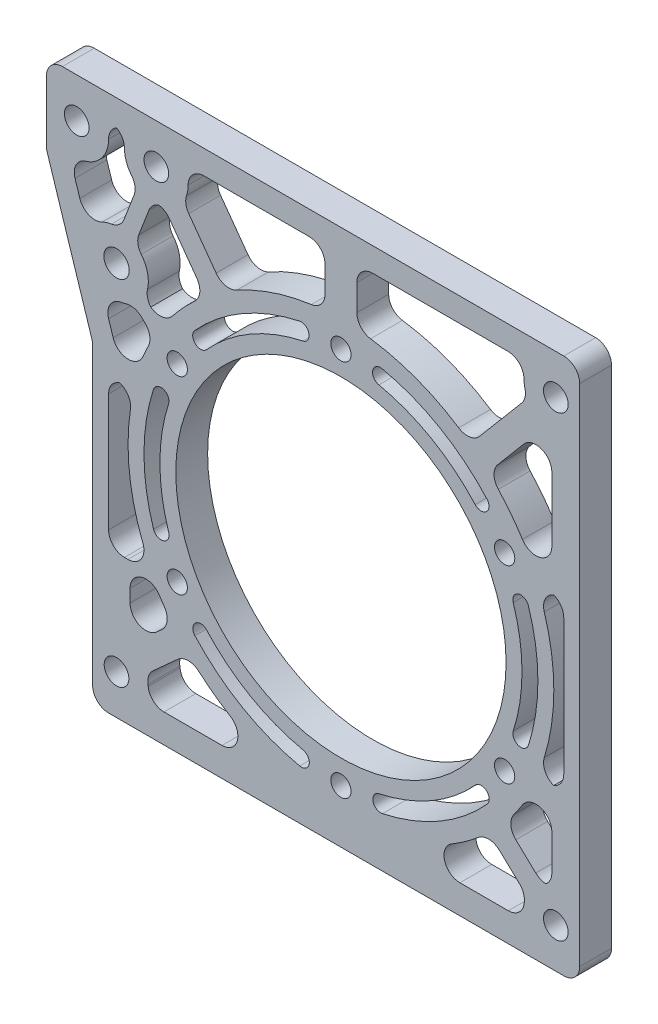
from build123d import *

# Parameters (mm, degrees)
SKETCH_1_R          = 1.55
SKETCH_1_R_2        = 1.6
SKETCH_1_R_3        = 1.275
SKETCH_1_R_4        = 20.75
EXTRUDE_1_DEPTH     = 4
CUT_EXTRUDE_1_DEPTH = 10
EXTRUDE_2_DEPTH     = 4
FILLET_1_R          = 2
FILLET_2_R          = 2
CUT_EXTRUDE_2_DEPTH = 10
FILLET_3_R          = 2
CUT_EXTRUDE_3_DEPTH = 10
FILLET_4_R          = 2


with BuildPart() as part:
    # 草图1 → 凸台-拉伸1 (new body)
    with BuildSketch(Plane.XY):
        Polygon((-37, 37), (-37, 27), (-31.2, 8.893125), (-31.2, -30.45), (30, -30.45), (30, 37), align=None)
        with Locations((-28.2, -25.45)):
            Circle(SKETCH_1_R, mode=Mode.SUBTRACT)
        with Locations((27, -25.45)):
            Circle(SKETCH_1_R, mode=Mode.SUBTRACT)
        with Locations((-28.2, 19)):
            Circle(SKETCH_1_R_2, mode=Mode.SUBTRACT)
        with Locations((-33.2, 32)):
            Circle(SKETCH_1_R, mode=Mode.SUBTRACT)
        with Locations((-23.2, 32)):
            Circle(SKETCH_1_R, mode=Mode.SUBTRACT)
        with Locations((27, 32)):
            Circle(SKETCH_1_R, mode=Mode.SUBTRACT)
        with Locations((20.56810334, 11.875)):
            Circle(SKETCH_1_R_3, mode=Mode.SUBTRACT)
        with Locations((0, 23.75)):
            Circle(SKETCH_1_R_3, mode=Mode.SUBTRACT)
        with Locations((-20.56810334, -11.875)):
            Circle(SKETCH_1_R_3, mode=Mode.SUBTRACT)
        with Locations((0, -23.75)):
            Circle(SKETCH_1_R_3, mode=Mode.SUBTRACT)
        Circle(SKETCH_1_R_4, mode=Mode.SUBTRACT)
        with Locations((20.56810334, -11.875)):
            Circle(SKETCH_1_R_3, mode=Mode.SUBTRACT)
        with Locations((-20.56810334, 11.875)):
            Circle(SKETCH_1_R_3, mode=Mode.SUBTRACT)
    extrude(amount=EXTRUDE_1_DEPTH)

    # 草图3 → 切除-拉伸1 (cut)
    with BuildSketch(Plane.XY.offset(4)):
        with BuildLine():
            ThreePointArc((-2.842094298, -26.85), (-18.240699261, -19.906704661), (-26.5, -5.172040216))
            Line((-26.5, -5.172040216), (-26.5, -21.829226602))
            ThreePointArc((-26.5, -21.829226602), (-24.823611397, -23.305238941), (-24.2, -25.45))
            ThreePointArc((-24.2, -25.45), (-24.263758443, -26.161338458), (-24.453001201, -26.85))
            Line((-24.453001201, -26.85), (-2.842094298, -26.85))
        make_face()
        with BuildLine():
            Line((26.5, -21.481373033), (26.5, -5.172040216))
            ThreePointArc((26.5, -5.172040216), (18.240699261, -19.906704661), (2.842094298, -26.85))
            Line((2.842094298, -26.85), (23.253001201, -26.85))
            ThreePointArc((23.253001201, -26.85), (23.577312667, -23.379924778), (26.5, -21.481373033))
        make_face()
        with BuildLine():
            ThreePointArc((-22.188158235, 28.13009351), (-26.380777443, 29.574581509), (-26.664101615, 34))
            Line((-26.664101615, 34), (-28.2, 34))
            Line((-28.2, 34), (-28.2, 23))
            ThreePointArc((-28.2, 23), (-26.048701334, 22.372226868), (-24.572666419, 20.685957025))
            Line((-24.572666419, 20.685957025), (-22.188158235, 28.13009351))
        make_face()
        with BuildLine():
            Line((-28.2, 23), (-28.2, 34))
            Line((-28.2, 34), (-29.735898385, 34))
            ThreePointArc((-29.735898385, 34), (-29.336296695, 33.03527618), (-29.2, 32))
            ThreePointArc((-29.2, 32), (-30.755349418, 28.83397986), (-34.211841765, 28.13009351))
            Line((-34.211841765, 28.13009351), (-31.827333581, 20.685957025))
            ThreePointArc((-31.827333581, 20.685957025), (-30.351298666, 22.372226868), (-28.2, 23))
        make_face()
        with BuildLine():
            Line((23.535898385, 34), (-19.735898385, 34))
            ThreePointArc((-19.735898385, 34), (-19.336296695, 33.03527618), (-19.2, 32))
            ThreePointArc((-19.2, 32), (-20.03397986, 29.555349418), (-22.188158235, 28.13009351))
            Line((-22.188158235, 28.13009351), (-24.572666419, 20.685957025))
            ThreePointArc((-24.572666419, 20.685957025), (-24.294277639, 19.863326611), (-24.2, 19))
            ThreePointArc((-24.2, 19), (-26.18637327, 15.543801598), (-30.172653696, 15.520253257))
            Line((-30.172653696, 15.520253257), (-26.629343566, 4.458481945))
            ThreePointArc((-26.629343566, 4.458481945), (-0.362593148, 26.99756519), (26.5, 5.172040216))
            Line((26.5, 5.172040216), (26.5, 28.031373033))
            ThreePointArc((26.5, 28.031373033), (23.417451693, 30.220857614), (23.535898385, 34))
        make_face()
    extrude(amount=-CUT_EXTRUDE_1_DEPTH, mode=Mode.SUBTRACT)

    # 草图4 → 凸台-拉伸2 (add)
    with BuildSketch(Plane.XY.offset(4)):
        Polygon((-26.516257498, 16.060033409), (-22.871840665, 12.657672096), (-21.507010027, 14.119601414), (-25.814048103, 18.140573874), align=None)
        Polygon((-25.073663933, 29.91415143), (-28.349086461, 21.398052857), (-26.206257495, 21.398052857), (-23.20697272, 29.196193271), align=None)
        Polygon((-22.689977833, 28.741013702), (-16.391570473, 20.053555275), (-13.962739143, 21.814457989), (-20.435109375, 30.741865206), align=None)
        Polygon((-2, 25.068796622), (-2, 35.260601513), (2, 34.683706896), (2, 26.158486453), align=None)
        Polygon((15.144686244, 20.275304594), (23.812232733, 30.547952285), (26.105107183, 28.613339467), (17.511605924, 18.428449087), align=None)
        Polygon((-20.408358069, -16.128240134), (-27.366474534, -22.407816874), (-25.35652789, -24.634948322), (-17.961616152, -17.961171593), align=None)
        Polygon((17.198262258, -18.272284712), (23.653008975, -24.356481155), (25.94176779, -22.391188055), (19.436545806, -16.259414), align=None)
    extrude(amount=-EXTRUDE_2_DEPTH)

    # 圆角1
    # the kernel refuses this fillet: 2 mm, written as the material it adds along each edge
    with BuildSketch(Plane(origin=(26.5, -5.172040216, 4), x_dir=(0, -1, 0), z_dir=(0, 0, -1))) as fillet_1_piece_1:
        with BuildLine():
            CenterArc((10.344080433, 2), FILLET_1_R, 122.346532129, 147.653467871)
            Line((9.274003147, 3.689655172), (9.252601601, 3.723448276))
            ThreePointArc((9.252601601, 3.723448276), (4.794189557, 1.449733253), (-0.007662282, 0.039259259))
            Line((-0.007662282, 0.039259259), (0, -0.04))
            Line((0, -0.04), (10.344080433, -0.04))
            Line((10.344080433, -0.04), (10.344080433, 0))
        make_face()
    extrude(amount=4)
    with BuildSketch(Plane(origin=(26.5, 5.172040216, 4), x_dir=(-0.3696672764454741, 0.9291641968594062, 0), z_dir=(0, 0, -1))) as fillet_1_piece_2:
        with BuildLine():
            CenterArc((10.35068374, 1.965539647), FILLET_1_R, 111.695098828, 147.653467871)
            Line((9.611349188, 3.823868041), (9.596562497, 3.861034609))
            Line((9.596562497, 3.861034609), (-0.014786691, 0.037166568))
            Line((-0.014786691, 0.037166568), (0.007393346, -0.039310793))
            ThreePointArc((0.007393346, -0.039310793), (4.990508232, 0.425214763), (9.973623118, -0.039310793))
            Line((9.973623118, -0.039310793), (9.981016464, 0))
        make_face()
    extrude(amount=4)
    with BuildSketch(Plane(origin=(26.5, 28.031373033, 4), x_dir=(0, -1, 0), z_dir=(0, 0, -1))) as fillet_1_piece_3:
        with BuildLine():
            CenterArc((1.389826656, 2), FILLET_1_R, 218.872973668, 51.127026332)
            Line((-0.167251886, 0.744808217), (-0.198393457, 0.719704381))
            ThreePointArc((-0.198393457, 0.719704381), (-0.104846097, 0.367638975), (-0.03968627, -0.005))
            Line((-0.03968627, -0.005), (0, -0.04))
            Line((0, -0.04), (1.389826656, -0.04))
            Line((1.389826656, -0.04), (1.389826656, 0))
        make_face()
    extrude(amount=4)
    with BuildSketch(Plane(origin=(18.531062197, 19.636693557, 0), x_dir=(0.7044568194517202, -0.709746848903161, 0), z_dir=(0, 0, 1)), Plane(origin=(18.588298073, -19.582522175, 0), x_dir=(-0.7473994868291617, -0.6643748995014079, 0), z_dir=(0, 0, 1)), Plane(origin=(-14.609232882, 22.706173491, 0), x_dir=(0.8582101658204371, 0.513298462185947, 0), z_dir=(0, 0, 1))) as fillet_1_piece_4:
        with BuildLine():
            CenterArc((1.830885237, 1.998930792), FILLET_1_R, 185.058322367, 83.068093802)
            Line((-0.161325693, 1.822591309), (-0.201169911, 1.81906452))
            Line((-0.201169911, 1.81906452), (-0.039844219, -0.00352679))
            Line((-0.039844219, -0.00352679), (0.001307775, -0.039978616))
            ThreePointArc((0.001307775, -0.039978616), (0.882748239, -0.025565689), (1.764188703, -0.039978616))
            Line((1.764188703, -0.039978616), (1.765496478, 0))
        make_face()
    extrude(amount=4)
    with BuildSketch(Plane(origin=(-26.664101615, 34, 4), x_dir=(-0.25881904510252357, -0.9659258262890674, 0), z_dir=(0, 0, -1)), Plane(origin=(23.535898385, 34, 4), x_dir=(-0.2588190451025201, -0.9659258262890685, 0), z_dir=(0, 0, -1))) as fillet_1_piece_5:
        with BuildLine():
            CenterArc((2.588190451, 1.931851653), FILLET_1_R, 165, 90)
            Line((0.656338798, 2.449489743), (0.617701765, 2.459842505))
            Line((0.617701765, 2.459842505), (-0.038637033, 0.010352762))
            Line((-0.038637033, 0.010352762), (0.010352762, -0.038637033))
            ThreePointArc((0.010352762, -0.038637033), (1.03527618, 0.096296695), (2.060199599, -0.038637033))
            Line((2.060199599, -0.038637033), (2.070552361, 0))
        make_face()
    extrude(amount=4)
    with BuildSketch(Plane(origin=(-29.735898385, 34, 4), x_dir=(1, 0, 0), z_dir=(0, 0, -1)), Plane(origin=(-19.735898385, 34, 4), x_dir=(1, 0, 0), z_dir=(0, 0, -1))) as fillet_1_piece_6:
        with BuildLine():
            CenterArc((2.535898385, 2), FILLET_1_R, 180, 90)
            Line((0.535898385, 2), (0.495898385, 2))
            ThreePointArc((0.495898385, 2), (0.360964657, 0.975076581), (-0.034641016, 0.02))
            Line((-0.034641016, 0.02), (0, -0.04))
            Line((0, -0.04), (2.535898385, -0.04))
            Line((2.535898385, -0.04), (2.535898385, 0))
        make_face()
    extrude(amount=4)
    with BuildSketch(Plane(origin=(-34.211841765, 28.13009351, 4), x_dir=(0.9998857758869276, 0.015114072217531128, 0), z_dir=(0, 0, -1))) as fillet_1_piece_7:
        with BuildLine():
            CenterArc((2.675540586, 1.927085702), FILLET_1_R, 163.104687221, 91.376541996)
            Line((0.761865861, 2.508333538), (0.723592366, 2.519958495))
            Line((0.723592366, 2.519958495), (-0.038273494, 0.011624957))
            Line((-0.038273494, 0.011624957), (0.010702162, -0.038541714))
            ThreePointArc((0.010702162, -0.038541714), (1.070216234, 0.105828596), (2.129730306, -0.038541714))
            Line((2.129730306, -0.038541714), (2.140432469, 0))
        make_face()
    extrude(amount=4)
    with BuildSketch(Plane(origin=(-31.827333581, 20.685957025, 4), x_dir=(-0.3050524308865609, 0.9523355576739746, 0), z_dir=(0, 0, -1))) as fillet_1_piece_8:
        with BuildLine():
            CenterArc((3.213764291, 2), FILLET_1_R, 170.985239348, 99.014760652)
            Line((1.238468278, 2.31337782), (1.198962357, 2.319645377))
            ThreePointArc((1.198962357, 2.319645377), (0.779065261, 1.071123218), (-0.027121237, 0.029401335))
            Line((-0.027121237, 0.029401335), (0, -0.04))
            Line((0, -0.04), (3.213764291, -0.04))
            Line((3.213764291, -0.04), (3.213764291, 0))
        make_face()
    extrude(amount=4)
    with BuildSketch(Plane(origin=(-27.74302561, 22.973811068, 0), x_dir=(-0.9997802281489468, -0.020964145640583874, 0), z_dir=(0, 0, 1)), Plane(origin=(-24.686570731, 17.087981493, 0), x_dir=(0.35500772832201655, 0.9348633658624351, 0), z_dir=(0, 0, 1)), Plane(origin=(-23.65697439, 28.026188932, 0), x_dir=(0.9997802281489468, 0.02096414564058723, 0), z_dir=(0, 0, 1))) as fillet_1_piece_9:
        with BuildLine():
            CenterArc((1.350453784, -1.981678829), FILLET_1_R, 97.761243907, 60)
            Line((-0.500775803, -1.224744871), (-0.537800395, -1.209606192))
            Line((-0.537800395, -1.209606192), (-0.037024592, 0.015138679))
            Line((-0.037024592, 0.015138679), (0.005401815, 0.039633577))
            ThreePointArc((0.005401815, 0.039633577), (0.540181513, 0.003357659), (1.074961212, 0.039633577))
            Line((1.074961212, 0.039633577), (1.080363027, 0))
        make_face()
    extrude(amount=4)
    with BuildSketch(Plane(origin=(-25.523665602, 28.74414709, 0), x_dir=(-0.7280567727843938, 0.6855168383072539, 0), z_dir=(0, 0, 1)), Plane(origin=(-26.051401369, 15.626052176, 0), x_dir=(-0.9082997007060751, -0.4183200374082674, 0), z_dir=(0, 0, 1)), Plane(origin=(-25.876334398, 22.25585291, 0), x_dir=(0.7280567727843936, -0.6855168383072539, 0), z_dir=(0, 0, 1))) as fillet_1_piece_10:
        with BuildLine():
            CenterArc((1.350453784, 1.981678829), FILLET_1_R, 202.238756093, 60)
            Line((-0.500775803, 1.224744871), (-0.537800395, 1.209606192))
            Line((-0.537800395, 1.209606192), (-0.037024592, -0.015138679))
            Line((-0.037024592, -0.015138679), (0.005401815, -0.039633577))
            ThreePointArc((0.005401815, -0.039633577), (0.540181513, -0.003357659), (1.074961212, -0.039633577))
            Line((1.074961212, -0.039633577), (1.080363027, 0))
        make_face()
    extrude(amount=4)
    with BuildSketch(Plane(origin=(-26.629343566, 4.458481945, 4), x_dir=(-0.30505243088655853, 0.9523355576739752, 0), z_dir=(0, 0, -1))) as fillet_1_piece_11:
        with BuildLine():
            CenterArc((6.525126751, 2), FILLET_1_R, 130.657248638, 139.342751362)
            Line((5.222061673, 3.517241379), (5.196000372, 3.547586207))
            ThreePointArc((5.196000372, 3.547586207), (2.691558896, 1.639060374), (-0.018324914, 0.035555556))
            Line((-0.018324914, 0.035555556), (0, -0.04))
            Line((0, -0.04), (6.525126751, -0.04))
            Line((6.525126751, -0.04), (6.525126751, 0))
        make_face()
    extrude(amount=4)
    with BuildSketch(Plane(origin=(-30.172653696, 15.520253257, 4), x_dir=(0.3050524308865576, -0.9523355576739755, 0), z_dir=(0, 0, -1))) as fillet_1_piece_12:
        with BuildLine():
            CenterArc((3.213764291, -2), FILLET_1_R, 90, 99.014760652)
            Line((1.238468278, -2.31337782), (1.198962357, -2.319645377))
            ThreePointArc((1.198962357, -2.319645377), (0.779065261, -1.071123218), (-0.027121237, -0.029401335))
            Line((-0.027121237, -0.029401335), (0, 0.04))
            Line((0, 0.04), (3.213764291, 0.04))
            Line((3.213764291, 0.04), (3.213764291, 0))
        make_face()
    extrude(amount=4)
    with BuildSketch(Plane(origin=(-23.518721711, 13.261588482, 0), x_dir=(-0.4671901867140015, -0.8841568466274162, 0), z_dir=(0, 0, 1))) as fillet_1_piece_13:
        with BuildLine():
            CenterArc((1.529854182, -1.999253543), FILLET_1_R, 91.565448117, 73.253937268)
            Line((-0.400356114, -1.47552822), (-0.43896032, -1.465053714))
            Line((-0.43896032, -1.465053714), (-0.038604206, 0.010474506))
            Line((-0.038604206, 0.010474506), (0.001092753, 0.039985071))
            ThreePointArc((0.001092753, 0.039985071), (0.737608267, 0.029922824), (1.47412378, 0.039985071))
            Line((1.47412378, 0.039985071), (1.475216533, 0))
        make_face()
    extrude(amount=4)
    with BuildSketch(Plane(origin=(-22.449982288, 14.999943176, 0), x_dir=(0.5886464024816235, 0.8083906313444278, 0), z_dir=(0, 0, 1))) as fillet_1_piece_14:
        with BuildLine():
            CenterArc((2.259263534, 1.998371699), FILLET_1_R, 173.028337417, 94.659494613)
            Line((0.274050925, 2.241128567), (0.234346672, 2.245983705))
            Line((0.234346672, 2.245983705), (-0.039704252, 0.004855137))
            Line((-0.039704252, 0.004855137), (0.00161376, -0.039967434))
            ThreePointArc((0.00161376, -0.039967434), (1.089287775, -0.018017943), (2.176961791, -0.039967434))
            Line((2.176961791, -0.039967434), (2.17857555, 0))
        make_face()
    extrude(amount=4)
    with BuildSketch(Plane(origin=(-22.237881657, 28.11743277, 0), x_dir=(-0.992359336250492, -0.12338131040187164, 0), z_dir=(0, 0, 1)), Plane(origin=(25.33053642, -21.815045894, 0), x_dir=(0.9519270489112265, 0.3063248170670529, 0), z_dir=(0, 0, 1)), Plane(origin=(23.462317333, 30.133237737, 0), x_dir=(-0.3581915861106433, 0.9336481069651145, 0), z_dir=(0, 0, 1))) as fillet_1_piece_15:
        with BuildLine():
            CenterArc((1.189327218, 1.985804631), FILLET_1_R, 208.854823775, 54.314665287)
            Line((-0.562363402, 1.020620726), (-0.597397215, 1.001317048))
            Line((-0.597397215, 1.001317048), (-0.035033812, -0.019303678))
            Line((-0.035033812, -0.019303678), (0.004757309, -0.039716093))
            ThreePointArc((0.004757309, -0.039716093), (0.475730887, -0.011609261), (0.946704466, -0.039716093))
            Line((0.946704466, -0.039716093), (0.951461775, 0))
        make_face()
    extrude(amount=4)
    with BuildSketch(Plane(origin=(-17.038064212, 20.945270777, 0), x_dir=(-0.7547046080004547, -0.6560647488341985, 0), z_dir=(0, 0, 1)), Plane(origin=(20.646030924, -17.399465713, 0), x_dir=(0.6190798045360487, 0.7853280815147309, 0), z_dir=(0, 0, 1)), Plane(origin=(16.238187746, 21.571306375, 0), x_dir=(-0.8181730271779358, 0.574972084190609, 0), z_dir=(0, 0, 1))) as fillet_1_piece_16:
        with BuildLine():
            CenterArc((1.830885237, -1.998930792), FILLET_1_R, 91.87358383, 83.068093802)
            Line((-0.161325693, -1.822591309), (-0.201169911, -1.81906452))
            Line((-0.201169911, -1.81906452), (-0.039844219, 0.00352679))
            Line((-0.039844219, 0.00352679), (0.001307775, 0.039978616))
            ThreePointArc((0.001307775, 0.039978616), (0.882748239, 0.025565689), (1.764188703, 0.039978616))
            Line((1.764188703, 0.039978616), (1.765496478, 0))
        make_face()
    extrude(amount=4)
    with BuildSketch(Plane(origin=(-26.5, -5.172040216, 4), x_dir=(0, -1, 0), z_dir=(0, 0, -1))) as fillet_1_piece_17:
        with BuildLine():
            CenterArc((10.344080433, -2), FILLET_1_R, 90, 147.653467871)
            Line((9.274003147, -3.689655172), (9.252601601, -3.723448276))
            ThreePointArc((9.252601601, -3.723448276), (4.794189557, -1.449733253), (-0.007662282, -0.039259259))
            Line((-0.007662282, -0.039259259), (0, 0.04))
            Line((0, 0.04), (10.344080433, 0.04))
            Line((10.344080433, 0.04), (10.344080433, 0))
        make_face()
    extrude(amount=4)
    with BuildSketch(Plane(origin=(-21.14338242, -16.791586579, 0), x_dir=(-0.5961642987472975, 0.8028624595154159, 0), z_dir=(0, 0, 1))) as fillet_1_piece_18:
        with BuildLine():
            CenterArc((1.817728363, 1.998946107), FILLET_1_R, 185.470015242, 82.669869386)
            Line((-0.17316408, 1.808296475), (-0.212981929, 1.804483483))
            Line((-0.212981929, 1.804483483), (-0.039817849, -0.003812993))
            Line((-0.039817849, -0.003812993), (0.001298377, -0.039978922))
            ThreePointArc((0.001298377, -0.039978922), (0.876404746, -0.02577245), (1.751511115, -0.039978922))
            Line((1.751511115, -0.039978922), (1.752809493, 0))
        make_face()
    extrude(amount=4)
    with BuildSketch(Plane(origin=(2.842094298, -26.85, 4), x_dir=(1, 0, 0), z_dir=(0, 0, -1))) as fillet_1_piece_19:
        with BuildLine():
            CenterArc((12.107069558, -2), FILLET_1_R, 90, 148.969893499)
            Line((11.07609274, -3.713793103), (11.055473204, -3.748068966))
            ThreePointArc((11.055473204, -3.748068966), (5.728593443, -1.288605053), (-0.00421051, -0.039777778))
            Line((-0.00421051, -0.039777778), (0, 0.04))
            Line((0, 0.04), (12.107069558, 0.04))
            Line((12.107069558, 0.04), (12.107069558, 0))
        make_face()
    extrude(amount=4)
    with BuildSketch(Plane(origin=(-2.842094298, -26.85, 4), x_dir=(-1, 0, 0), z_dir=(0, 0, -1))) as fillet_1_piece_20:
        with BuildLine():
            CenterArc((12.107069558, 2), FILLET_1_R, 121.030106501, 148.969893499)
            Line((11.07609274, 3.713793103), (11.055473204, 3.748068966))
            ThreePointArc((11.055473204, 3.748068966), (5.728593443, 1.288605053), (-0.00421051, 0.039777778))
            Line((-0.00421051, 0.039777778), (0, -0.04))
            Line((0, -0.04), (12.107069558, -0.04))
            Line((12.107069558, -0.04), (12.107069558, 0))
        make_face()
    extrude(amount=4)
    with BuildSketch(Plane(origin=(-24.453001201, -26.85, 4), x_dir=(0.1283468289940273, 0.991729343867155, 0), z_dir=(0, 0, -1))) as fillet_1_piece_21:
        with BuildLine():
            CenterArc((2.268764168, 1.947847111), FILLET_1_R, 172.625927681, 84.260829523)
            Line((0.285305481, 2.204540769), (0.245636307, 2.209674642))
            Line((0.245636307, 2.209674642), (-0.039669174, 0.005133873))
            Line((-0.039669174, 0.005133873), (0.009075057, -0.038956942))
            ThreePointArc((0.009075057, -0.038956942), (0.907505667, 0.064305779), (1.805936278, -0.038956942))
            Line((1.805936278, -0.038956942), (1.815011335, 0))
        make_face()
    extrude(amount=4)
    with BuildSketch(Plane(origin=(-24.520717219, -23.880644011, 0), x_dir=(0.2739491164245754, -0.9617441871985473, 0), z_dir=(0, 0, 1))) as fillet_1_piece_22:
        with BuildLine():
            CenterArc((1.253456833, 1.984226257), FILLET_1_R, 206.166293979, 56.632987031)
            Line((-0.541579054, 1.102270384), (-0.577479772, 1.084631267))
            Line((-0.577479772, 1.084631267), (-0.035900718, -0.017639117))
            Line((-0.035900718, -0.017639117), (0.005013827, -0.039684525))
            ThreePointArc((0.005013827, -0.039684525), (0.501382733, -0.008452514), (0.997751639, -0.039684525))
            Line((0.997751639, -0.039684525), (1.002765467, 0))
        make_face()
    extrude(amount=4)
    with BuildSketch(Plane(origin=(-19.14995902, -19.033629962, 0), x_dir=(0.7279232898879716, -0.6856585768723906, 0), z_dir=(0, 0, 1))) as fillet_1_piece_23:
        with BuildLine():
            CenterArc((1.844120524, -1.998915273), FILLET_1_R, 91.887132664, 83.465981993)
            Line((-0.149305311, -1.836886143), (-0.189173828, -1.83364556))
            Line((-0.189173828, -1.83364556), (-0.039868517, 0.003240583))
            Line((-0.039868517, 0.003240583), (0.001317229, 0.039978305))
            ThreePointArc((0.001317229, 0.039978305), (0.889129539, 0.025356189), (1.776941848, 0.039978305))
            Line((1.776941848, 0.039978305), (1.778259077, 0))
        make_face()
    extrude(amount=4)
    with BuildSketch(Plane(origin=(23.253001201, -26.85, 4), x_dir=(-1, 0, 0), z_dir=(0, 0, -1))) as fillet_1_piece_24:
        with BuildLine():
            CenterArc((2.222925824, 2), FILLET_1_R, 185.739170477, 84.260829523)
            Line((0.232950949, 1.8), (0.193151452, 1.796))
            ThreePointArc((0.193151452, 1.796), (0.180249403, 0.891746557), (-0.037469988, 0.014))
            Line((-0.037469988, 0.014), (0, -0.04))
            Line((0, -0.04), (2.222925824, -0.04))
            Line((2.222925824, -0.04), (2.222925824, 0))
        make_face()
    extrude(amount=4)
    with BuildSketch(Plane(origin=(23.27280357, -23.998102356, 0), x_dir=(-0.24957672905830122, -0.9683550259654562, 0), z_dir=(0, 0, 1)), Plane(origin=(-19.809050327, 29.878335484, 0), x_dir=(0.4258276838781078, 0.9048042791913654, 0), z_dir=(0, 0, 1))) as fillet_1_piece_25:
        with BuildLine():
            CenterArc((1.189327218, -1.985804631), FILLET_1_R, 96.830510938, 54.314665287)
            Line((-0.562363402, -1.020620726), (-0.597397215, -1.001317048))
            Line((-0.597397215, -1.001317048), (-0.035033812, 0.019303678))
            Line((-0.035033812, 0.019303678), (0.004757309, 0.039716093))
            ThreePointArc((0.004757309, 0.039716093), (0.475730887, 0.011609261), (0.946704466, 0.039716093))
            Line((0.946704466, 0.039716093), (0.951461775, 0))
        make_face()
    extrude(amount=4)
    with BuildSketch(Plane(origin=(26.5, -21.481373033, 4), x_dir=(-0.9617291776457981, -0.27400180449175315, 0), z_dir=(0, 0, -1))) as fillet_1_piece_26:
        with BuildLine():
            CenterArc((1.516365903, 1.976872626), FILLET_1_R, 195.902537067, 65.375681648)
            Line((-0.407092452, 1.428869017), (-0.445561619, 1.417908944))
            Line((-0.445561619, 1.417908944), (-0.038469167, -0.010960072))
            Line((-0.038469167, -0.010960072), (0.006065464, -0.039537453))
            ThreePointArc((0.006065464, -0.039537453), (0.606546361, 0.006254749), (1.207027259, -0.039537453))
            Line((1.207027259, -0.039537453), (1.213092723, 0))
        make_face()
    extrude(amount=4)
    with BuildSketch(Plane(origin=(2, 26.925824036, 0), x_dir=(0.9943600260342214, -0.10605724221015177, 0), z_dir=(0, 0, 1))) as fillet_1_piece_27:
        with BuildLine():
            CenterArc((1.798136334, 1.998968709), FILLET_1_R, 186.088082216, 82.071858234)
            Line((-0.190583719, 1.786854225), (-0.23035812, 1.782611935))
            Line((-0.23035812, 1.782611935), (-0.039774401, -0.00424229))
            Line((-0.039774401, -0.00424229), (0.001284383, -0.039979374))
            ThreePointArc((0.001284383, -0.039979374), (0.866958589, -0.026077574), (1.732632796, -0.039979374))
            Line((1.732632796, -0.039979374), (1.733917179, 0))
        make_face()
    extrude(amount=4)
    with BuildSketch(Plane(origin=(2, 34, 0), x_dir=(1, 0, 0), z_dir=(0, 0, 1)), Plane(origin=(-2, 34, 4), x_dir=(-1, 0, 0), z_dir=(0, 0, -1))) as fillet_1_piece_28:
        with BuildLine():
            CenterArc((FILLET_1_R, -FILLET_1_R), FILLET_1_R, 90, 90)
            Line((0, -FILLET_1_R), (-FILLET_1_R * 0.02, -FILLET_1_R))
            Line((-FILLET_1_R * 0.02, -FILLET_1_R), (-FILLET_1_R * 0.02, FILLET_1_R * 0.02))
            Line((-FILLET_1_R * 0.02, FILLET_1_R * 0.02), (FILLET_1_R, FILLET_1_R * 0.02))
            Line((FILLET_1_R, FILLET_1_R * 0.02), (FILLET_1_R, 0))
        make_face()
    extrude(amount=4)
    with BuildSketch(Plane(origin=(-2, 26.925824036, 0), x_dir=(-0.9943600260342214, -0.10605724221015175, 0), z_dir=(0, 0, 1))) as fillet_1_piece_29:
        with BuildLine():
            CenterArc((1.798136334, -1.998968709), FILLET_1_R, 91.84005955, 82.071858234)
            Line((-0.190583719, -1.786854225), (-0.23035812, -1.782611935))
            Line((-0.23035812, -1.782611935), (-0.039774401, 0.00424229))
            Line((-0.039774401, 0.00424229), (0.001284383, 0.039979374))
            ThreePointArc((0.001284383, 0.039979374), (0.866958589, 0.026077574), (1.732632796, 0.039979374))
            Line((1.732632796, 0.039979374), (1.733917179, 0))
        make_face()
    extrude(amount=4)
    with BuildSketch(Plane(origin=(-26.5, -21.625838969, 4), x_dir=(0, 1, 0), z_dir=(0, 0, -1))) as fillet_1_piece_30:
        with BuildLine():
            CenterArc((FILLET_1_R * 2.24950648858, FILLET_1_R), FILLET_1_R, 137.934307863, 132.065692137)
            Line((FILLET_1_R * 1.50712933912, FILLET_1_R * 1.66998221467), (FILLET_1_R * 1.49228179613, FILLET_1_R * 1.68338185896))
            Line((FILLET_1_R * 1.49228179613, FILLET_1_R * 1.68338185896), (-FILLET_1_R * 0.0148475429891, FILLET_1_R * 0.0133996442933))
            Line((-FILLET_1_R * 0.0148475429891, FILLET_1_R * 0.0133996442933), (0, -FILLET_1_R * 0.02))
            Line((0, -FILLET_1_R * 0.02), (FILLET_1_R * 2.24950648858, -FILLET_1_R * 0.02))
            Line((FILLET_1_R * 2.24950648858, -FILLET_1_R * 0.02), (FILLET_1_R * 2.24950648858, 0))
        make_face()
    extrude(amount=4)

    # 圆角2
    # the kernel refuses this fillet: 2 mm, written as the material it adds along each edge
    with BuildSketch(Plane(origin=(25.755191783, 28.198624919, 0), x_dir=(0.16020552475095626, -0.987083679248761, 0), z_dir=(0, 0, 1))) as fillet_2_piece_1:
        with BuildLine():
            CenterArc((4.328668424, -1.974167358), FILLET_2_R, 80.78117419, 139.844000375)
            Line((2.810697829, -3.276382883), (2.658900769, -3.406604436))
            Line((2.658900769, -3.406604436), (-0.151797059, -0.130221552))
            Line((-0.151797059, -0.130221552), (-0.133587816, 0.148843191))
            ThreePointArc((-0.133587816, 0.148843191), (1.688330313, 0.683152186), (4.681120578, 0.197416736))
            Line((4.681120578, 0.197416736), (4.649079473, 0))
        make_face()
    extrude(amount=4)

    # 草图5 → 切除-拉伸2 (cut)
    with BuildSketch(Plane.XY.offset(4)):
        with BuildLine():
            ThreePointArc((-4.789473684, 22.240131336), (-11.386782365, 19.695270685), (-16.884034145, 15.247684775))
            ThreePointArc((-16.884034145, 15.247684775), (-18.296417394, 15.17575733), (-18.368344839, 16.588140579))
            ThreePointArc((-18.368344839, 16.588140579), (-12.387818178, 21.426723053), (-5.210526316, 24.195307717))
            ThreePointArc((-5.210526316, 24.195307717), (-4.022411809, 23.428245842), (-4.789473684, 22.240131336))
        make_face()
        with BuildLine():
            ThreePointArc((16.865781878, 15.267871549), (11.363213565, 19.708878138), (4.762865291, 22.245844875))
            ThreePointArc((4.762865291, 22.245844875), (3.994382672, 23.433040927), (5.181578723, 24.201523546))
            ThreePointArc((5.181578723, 24.201523546), (12.362177395, 21.441526766), (18.348487977, 16.610102015))
            ThreePointArc((18.348487977, 16.610102015), (18.278250161, 15.197633732), (16.865781878, 15.267871549))
        make_face()
        with BuildLine():
            ThreePointArc((21.655255562, -6.972259787), (22.74999593, 0.013607453), (21.646899436, 6.998160101))
            ThreePointArc((21.646899436, 6.998160101), (22.290800066, 8.257283597), (23.549923563, 7.613382967))
            ThreePointArc((23.549923563, 7.613382967), (24.749995573, 0.014803713), (23.559014293, -7.585205702))
            ThreePointArc((23.559014293, -7.585205702), (22.30066197, -8.23061211), (21.655255562, -6.972259787))
        make_face()
        with BuildLine():
            ThreePointArc((4.789473684, -22.240131336), (11.386782365, -19.695270685), (16.884034145, -15.247684775))
            ThreePointArc((16.884034145, -15.247684775), (18.296417394, -15.17575733), (18.368344839, -16.588140579))
            ThreePointArc((18.368344839, -16.588140579), (12.387818178, -21.426723053), (5.210526316, -24.195307717))
            ThreePointArc((5.210526316, -24.195307717), (4.022411809, -23.428245842), (4.789473684, -22.240131336))
        make_face()
        with BuildLine():
            ThreePointArc((-16.865781878, -15.267871549), (-11.363213565, -19.708878138), (-4.762865291, -22.245844875))
            ThreePointArc((-4.762865291, -22.245844875), (-3.994382672, -23.433040927), (-5.181578723, -24.201523546))
            ThreePointArc((-5.181578723, -24.201523546), (-12.362177395, -21.441526766), (-18.348487977, -16.610102015))
            ThreePointArc((-18.348487977, -16.610102015), (-18.278250161, -15.197633732), (-16.865781878, -15.267871549))
        make_face()
        with BuildLine():
            ThreePointArc((-21.655255562, 6.972259787), (-22.74999593, -0.013607453), (-21.646899436, -6.998160101))
            ThreePointArc((-21.646899436, -6.998160101), (-22.290800066, -8.257283597), (-23.549923563, -7.613382967))
            ThreePointArc((-23.549923563, -7.613382967), (-24.749995573, -0.014803713), (-23.559014293, 7.585205702))
            ThreePointArc((-23.559014293, 7.585205702), (-22.30066197, 8.23061211), (-21.655255562, 6.972259787))
        make_face()
    extrude(amount=-CUT_EXTRUDE_2_DEPTH, mode=Mode.SUBTRACT)

    # 圆角3
    fillet_3_edges = [part.edges().sort_by_distance(p)[0] for p in [
        (-31.2, 8.893125, 2),
        (-37, 27, 2),
        (-37, 37, 2),
        (30, 37, 2),
        (30, -30.45, 2),
        (-31.2, -30.45, 2),
    ]]
    fillet(fillet_3_edges, radius=FILLET_3_R)

    # 草图7 → 切除-拉伸3 (cut)
    with BuildSketch(Plane.XY.offset(4)):
        with BuildLine():
            Line((28, 10.516120649), (24.596213255, 10.516120649))
            ThreePointArc((24.596213255, 10.516120649), (26.206022252, 5.367205764), (26.75, 0))
            ThreePointArc((26.75, 0), (26.206022252, -5.367205764), (24.596213255, -10.516120649))
            Line((24.596213255, -10.516120649), (28, -10.516120649))
            Line((28, -10.516120649), (28, 10.516120649))
        make_face()
        with BuildLine():
            ThreePointArc((-23.641261047, -12.516120649), (-26.541583379, -3.332694362), (-26.001734904, 6.28269703))
            Line((-26.001734904, 6.28269703), (-29.2, 6.28269703))
            Line((-29.2, 6.28269703), (-29.2, -12.516120649))
            Line((-29.2, -12.516120649), (-23.641261047, -12.516120649))
        make_face()
    extrude(amount=-CUT_EXTRUDE_3_DEPTH, mode=Mode.SUBTRACT)

    # 圆角4
    # the kernel refuses this fillet: 2 mm, written as the material it adds along each edge
    with BuildSketch(Plane(origin=(24.596213255, 10.516120649, 4), x_dir=(0.34512973482920384, -0.9385549883393746, 0), z_dir=(0, 0, -1))) as fillet_4_piece_1:
        with BuildLine():
            CenterArc((2.865403659, -1.997332679), FILLET_4_R, 92.959433514, 107.230281948)
            Line((0.988293682, -2.687592148), (0, 0))
            ThreePointArc((0, 0), (1.381072935, -0.035675424), (2.762145869, 0))
        make_face()
    extrude(amount=4)
    with BuildSketch(Plane(origin=(28, 10.516120649, 4), x_dir=(-1, 0, 0), z_dir=(0, 0, -1)), Plane(origin=(-29.2, -12.516120649, 4), x_dir=(1, 0, 0), z_dir=(0, 0, -1)), Plane(origin=(-29.2, 6.28269703, 4), x_dir=(0, -1, 0), z_dir=(0, 0, -1))) as fillet_4_piece_2:
        with BuildLine():
            CenterArc((FILLET_4_R, -FILLET_4_R), FILLET_4_R, 90, 90)
            Line((0, -FILLET_4_R), (0, 0))
            Line((0, 0), (FILLET_4_R, 0))
        make_face()
    extrude(amount=4)
    with BuildSketch(Plane(origin=(28, -10.516120649, 4), x_dir=(-1, 0, 0), z_dir=(0, 0, -1))) as fillet_4_piece_3:
        with BuildLine():
            CenterArc((FILLET_4_R, FILLET_4_R), FILLET_4_R, 180, 90)
            Line((0, FILLET_4_R), (0, 0))
            Line((0, 0), (FILLET_4_R, 0))
        make_face()
    extrude(amount=4)
    with BuildSketch(Plane(origin=(24.596213255, -10.516120649, 4), x_dir=(1, 0, 0), z_dir=(0, 0, -1))) as fillet_4_piece_4:
        with BuildLine():
            CenterArc((2.863542554, -2), FILLET_4_R, 90, 107.230281948)
            ThreePointArc((0.953298671, -2.592425784), (0.510132683, -1.283900243), (0, 0))
            Line((0, 0), (2.863542554, 0))
        make_face()
    extrude(amount=4)
    with BuildSketch(Plane(origin=(-26.001734904, 6.28269703, 4), x_dir=(-0.192099353342535, -0.9813754829041635, 0), z_dir=(0, 0, -1))) as fillet_4_piece_5:
        with BuildLine():
            CenterArc((2.429070825, 1.998083528), FILLET_4_R, 168.924674524, 98.566857408)
            Line((0.466319859, 2.382282235), (0, 0))
            ThreePointArc((0, 0), (1.17076837, 0.025632815), (2.341536741, 0))
        make_face()
    extrude(amount=4)
    with BuildSketch(Plane(origin=(-23.641261047, -12.516120649, 4), x_dir=(-0.4174947972376761, 0.9086793132230269, 0), z_dir=(0, 0, -1))) as fillet_4_piece_6:
        with BuildLine():
            CenterArc((3.118449412, -1.996840382), FILLET_4_R, 93.221047562, 111.455476736)
            Line((1.301090786, -2.831829976), (0, 0))
            ThreePointArc((0, 0), (1.503036428, -0.042259895), (3.006072857, 0))
        make_face()
    extrude(amount=4)


solid = part.part
